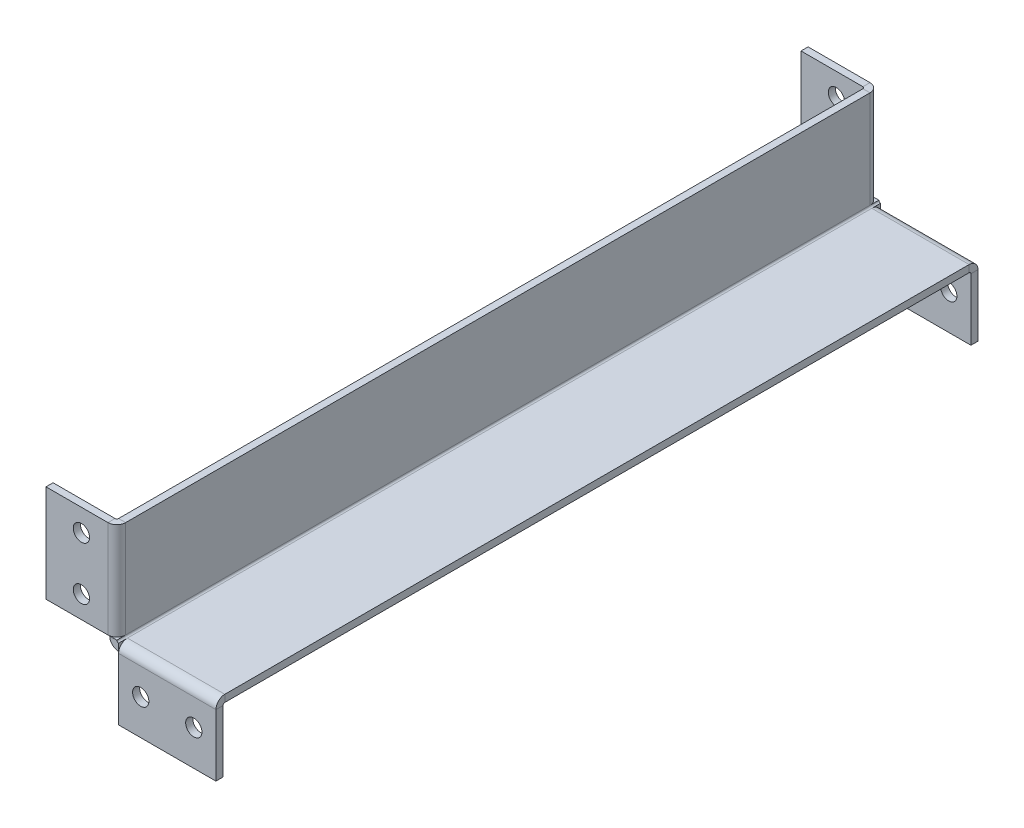
from build123d import *

# Parameters (mm, degrees)
SKETCH1_W                      = 60
SKETCH1_H                      = 430.5
BASE_FLANGE1_DEPTH             = 4
EDGE_FLANGE1_STRIP_W           = 18
EDGE_FLANGE1_STRIP_H           = 4
EDGE_FLANGE1_STRIP_CUT_DEPTH   = 430.5
EDGE_FLANGE1_DEPTH             = 430.5
EDGE_FLANGE2_STRIP_W           = 18
EDGE_FLANGE2_STRIP_H           = 4
EDGE_FLANGE2_STRIP_CUT_DEPTH   = 55
EDGE_FLANGE2_STRIP_2_W         = 18
EDGE_FLANGE2_STRIP_2_H         = 4
EDGE_FLANGE2_STRIP_CUT_2_DEPTH = 55
EDGE_FLANGE2_STRIP_3_W         = 18
EDGE_FLANGE2_STRIP_3_H         = 4
EDGE_FLANGE2_STRIP_CUT_3_DEPTH = 55
EDGE_FLANGE2_STRIP_4_W         = 18
EDGE_FLANGE2_STRIP_4_H         = 4
EDGE_FLANGE2_STRIP_CUT_4_DEPTH = 55
EDGE_FLANGE2_DEPTH             = 55
EDGE_FLANGE2_BEND_DEPTH        = 55
EDGE_FLANGE2_BEND_2_DEPTH      = 55
EDGE_FLANGE2_BEND_3_DEPTH      = 55
SKETCH18_R                     = 4.6
EXTRUDE1_DEPTH                 = 440.643321341


# Sheet-metal steps are written as plain solids
with BuildPart() as part:
    # Sketch1 → Base-Flange1 (new body)
    with BuildSketch(Plane(origin=(0, 0, 0), x_dir=(1, 0, 0), z_dir=(0, 1, 0))):
        Rectangle(SKETCH1_W, SKETCH1_H)
    extrude(amount=BASE_FLANGE1_DEPTH)

    # Edge-Flange1 strip (across the edge) → Edge-Flange1 strip cut (cut)
    with BuildSketch(Plane(origin=(-30, 4, -215.25), x_dir=(1, 0, 0), z_dir=(0, 0, 1))):
        with Locations((-4, -2)):
            Rectangle(EDGE_FLANGE1_STRIP_W, EDGE_FLANGE1_STRIP_H)
    extrude(amount=EDGE_FLANGE1_STRIP_CUT_DEPTH, mode=Mode.SUBTRACT)

    # Edge-Flange1 section (across the edge) → Edge-Flange1 (add)
    with BuildSketch(Plane(origin=(-30, 4, -215.25), x_dir=(1, 0, 0), z_dir=(0, 0, 1))):
        with BuildLine():
            Line((0, 1), (0, 56))
            Line((0, 56), (4, 56))
            Line((4, 56), (4, 1))
            ThreePointArc((4, 1), (4.292893219, 0.292893219), (5, 0))
            Line((5, 0), (5, -4))
            ThreePointArc((5, -4), (1.464466094, -2.535533906), (0, 1))
        make_face()
    extrude(amount=EDGE_FLANGE1_DEPTH)

    # Edge-Flange2 strip (across the edge) → Edge-Flange2 strip cut (cut)
    with BuildSketch(Plane(origin=(-30, 5, 215.25), x_dir=(0, 0, -1), z_dir=(0, 1, 0))):
        with Locations((-4, -2)):
            Rectangle(EDGE_FLANGE2_STRIP_W, EDGE_FLANGE2_STRIP_H)
    extrude(amount=EDGE_FLANGE2_STRIP_CUT_DEPTH, mode=Mode.SUBTRACT)

    # Edge-Flange2 strip 2 (across the edge) → Edge-Flange2 strip cut 2 (cut)
    with BuildSketch(Plane(origin=(30, 0, 215.25), x_dir=(0, 0, -1), z_dir=(-1, 0, 0))):
        with Locations((-4, -2)):
            Rectangle(EDGE_FLANGE2_STRIP_2_W, EDGE_FLANGE2_STRIP_2_H)
    extrude(amount=EDGE_FLANGE2_STRIP_CUT_2_DEPTH, mode=Mode.SUBTRACT)

    # Edge-Flange2 strip 3 (across the edge) → Edge-Flange2 strip cut 3 (cut)
    with BuildSketch(Plane(origin=(-30, 60, -215.25), x_dir=(0, 0, 1), z_dir=(0, -1, 0))):
        with Locations((-4, -2)):
            Rectangle(EDGE_FLANGE2_STRIP_3_W, EDGE_FLANGE2_STRIP_3_H)
    extrude(amount=EDGE_FLANGE2_STRIP_CUT_3_DEPTH, mode=Mode.SUBTRACT)

    # Edge-Flange2 strip 4 (across the edge) → Edge-Flange2 strip cut 4 (cut)
    with BuildSketch(Plane(origin=(-25, 0, -215.25), x_dir=(0, 0, 1), z_dir=(1, 0, 0))):
        with Locations((-4, -2)):
            Rectangle(EDGE_FLANGE2_STRIP_4_W, EDGE_FLANGE2_STRIP_4_H)
    extrude(amount=EDGE_FLANGE2_STRIP_CUT_4_DEPTH, mode=Mode.SUBTRACT)

    # Edge-Flange2 section (across the edge) → Edge-Flange2 (add)
    with BuildSketch(Plane(origin=(-30, 5, 215.25), x_dir=(0, 0, -1), z_dir=(0, 1, 0))):
        with BuildLine():
            Line((0, 1), (0, 36))
            Line((0, 36), (4, 36))
            Line((4, 36), (4, 1))
            ThreePointArc((4, 1), (4.292893219, 0.292893219), (5, 0))
            Line((5, 0), (5, -4))
            ThreePointArc((5, -4), (1.464466094, -2.535533906), (0, 1))
        make_face()
    extrude(amount=EDGE_FLANGE2_DEPTH)

    # Edge-Flange2 section 2 (across the edge) → Edge-Flange2 bend (add)
    with BuildSketch(Plane(origin=(30, 0, 215.25), x_dir=(0, 0, -1), z_dir=(-1, 0, 0))):
        with BuildLine():
            Line((0, 1), (0, 36))
            Line((0, 36), (4, 36))
            Line((4, 36), (4, 1))
            ThreePointArc((4, 1), (4.292893219, 0.292893219), (5, 0))
            Line((5, 0), (5, -4))
            ThreePointArc((5, -4), (1.464466094, -2.535533906), (0, 1))
        make_face()
    extrude(amount=EDGE_FLANGE2_BEND_DEPTH)

    # Edge-Flange2 section 3 (across the edge) → Edge-Flange2 bend 2 (add)
    with BuildSketch(Plane(origin=(-30, 60, -215.25), x_dir=(0, 0, 1), z_dir=(0, -1, 0))):
        with BuildLine():
            Line((0, 1), (0, 36))
            Line((0, 36), (4, 36))
            Line((4, 36), (4, 1))
            ThreePointArc((4, 1), (4.292893219, 0.292893219), (5, 0))
            Line((5, 0), (5, -4))
            ThreePointArc((5, -4), (1.464466094, -2.535533906), (0, 1))
        make_face()
    extrude(amount=EDGE_FLANGE2_BEND_2_DEPTH)

    # Edge-Flange2 section 4 (across the edge) → Edge-Flange2 bend 3 (add)
    with BuildSketch(Plane(origin=(-25, 0, -215.25), x_dir=(0, 0, 1), z_dir=(1, 0, 0))):
        with BuildLine():
            Line((0, 1), (0, 36))
            Line((0, 36), (4, 36))
            Line((4, 36), (4, 1))
            ThreePointArc((4, 1), (4.292893219, 0.292893219), (5, 0))
            Line((5, 0), (5, -4))
            ThreePointArc((5, -4), (1.464466094, -2.535533906), (0, 1))
        make_face()
    extrude(amount=EDGE_FLANGE2_BEND_3_DEPTH)

    # Sketch18 → Extrude1 (cut, through all)
    with BuildSketch(Plane.XY.offset(215.25)):
        with Locations((-46, 47.5)):
            Circle(SKETCH18_R)
        with Locations((-46, 17.5)):
            Circle(SKETCH18_R)
        with Locations((-12.5, -16)):
            Circle(SKETCH18_R)
        with Locations((17.5, -16)):
            Circle(SKETCH18_R)
    extrude(amount=-EXTRUDE1_DEPTH, mode=Mode.SUBTRACT)


solid = part.part
